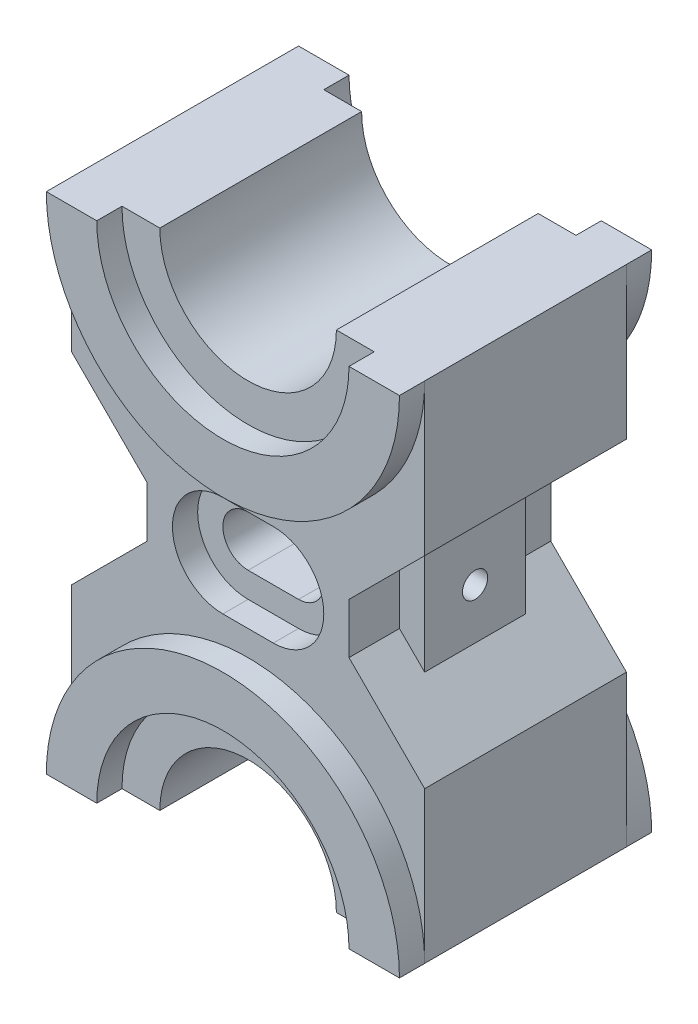
from build123d import *
from build123d.topology import SkipClean

# Parameters (mm, degrees)
SKETCH1_W           = 140
SKETCH1_H           = 200
BOSS_EXTRUDE1_DEPTH = 100
CUT_EXTRUDE1_DEPTH  = 100
CUT_EXTRUDE2_DEPTH  = 100
BOSS_EXTRUDE2_DEPTH = 10
CUT_EXTRUDE7_DEPTH  = 30
CUT_EXTRUDE8_DEPTH  = 10
CUT_EXTRUDE9_DEPTH  = 50
CUT_EXTRUDE10_DEPTH = 50
CUT_EXTRUDE11_DEPTH = 10
CUT_EXTRUDE12_START = -10
CUT_EXTRUDE12_DEPTH = 10
CUT_EXTRUDE13_DEPTH = 141
SKETCH19_R          = 5
CUT_EXTRUDE16_DEPTH = 30
CUT_EXTRUDE18_DEPTH = 60
CUT_EXTRUDE19_DEPTH = 10
SKETCH27_W          = 10
SKETCH27_H          = 80
CUT_EXTRUDE25_DEPTH = 177
CUT_EXTRUDE26_DEPTH = 10
SKETCH29_W          = 72.11102551
SKETCH29_H          = 10
EXTRUDE_THIN1_DEPTH = 10
CUT_EXTRUDE27_START = -10
CUT_EXTRUDE27_DEPTH = 10
BOSS_EXTRUDE4_START = -10
BOSS_EXTRUDE4_DEPTH = 10
CUT_EXTRUDE28_DEPTH = 150
CUT_EXTRUDE29_DEPTH = 10
BOSS_EXTRUDE5_DEPTH = 10
CUT_EXTRUDE30_START = -10
CUT_EXTRUDE30_DEPTH = 10
CUT_EXTRUDE31_START = -10
CUT_EXTRUDE31_DEPTH = 10
BOSS_EXTRUDE6_START = -10
BOSS_EXTRUDE6_DEPTH = 10
CUT_EXTRUDE32_DEPTH = 10
CUT_EXTRUDE33_DEPTH = 49
CUT_EXTRUDE34_START = -10
CUT_EXTRUDE34_DEPTH = 10
CUT_EXTRUDE42_START = -30.15
SKETCH43_R          = 5
CUT_EXTRUDE42_DEPTH = 30.15
SKETCH44_R          = 5
CUT_EXTRUDE43_DEPTH = 30.15
SKETCH45_R          = 5
CUT_EXTRUDE44_DEPTH = 120


with BuildPart() as part:
    # Sketch1 → Boss-Extrude1 (new body)
    with BuildSketch(Plane.XY):
        with Locations((70, 100)):
            Rectangle(SKETCH1_W, SKETCH1_H)
    extrude(amount=BOSS_EXTRUDE1_DEPTH)

    # Sketch2 → Cut-Extrude1 (cut)
    with BuildSketch(Plane.XY.offset(100)):
        Polygon((0, 140), (20, 120), (20, 80), (0, 60), align=None)
        Polygon((140, 140), (120, 120), (120, 80), (140, 60), align=None)
    extrude(amount=-CUT_EXTRUDE1_DEPTH, mode=Mode.SUBTRACT)

    # Sketch4 → Cut-Extrude2 (cut)
    with BuildSketch(Plane.XY.offset(30)):
        Polygon((20, 120), (30, 110), (30, 90), (20, 80), align=None)
    extrude(amount=-CUT_EXTRUDE2_DEPTH, mode=Mode.SUBTRACT)

    # Sketch9 → Boss-Extrude2 (add)
    with BuildSketch(Plane(origin=(0, 0, 30), x_dir=(-1, 0, 0), z_dir=(0, 0, -1))):
        Polygon((-30, 110), (-20, 120), (-20, 80), (-30, 90), align=None)
    extrude(amount=BOSS_EXTRUDE2_DEPTH)

    # Sketch10 → Cut-Extrude7 (cut)
    with BuildSketch(Plane.XY.offset(100)):
        Polygon((20, 120), (30, 110), (30, 90), (20, 80), align=None)
    extrude(amount=-CUT_EXTRUDE7_DEPTH, mode=Mode.SUBTRACT)

    # Sketch11 → Cut-Extrude8 (cut)
    with BuildSketch(Plane(origin=(0, 0, 20), x_dir=(-1, 0, 0), z_dir=(0, 0, -1))):
        Polygon((-30, 110), (-20, 120), (-20, 80), (-30, 90), align=None)
    extrude(amount=-CUT_EXTRUDE8_DEPTH, mode=Mode.SUBTRACT)

    # Sketch13 → Cut-Extrude9 (cut)
    with BuildSketch(Plane.XY.offset(70)):
        Polygon((120, 120), (110, 110), (110, 90), (120, 80), align=None)
    extrude(amount=CUT_EXTRUDE9_DEPTH, mode=Mode.SUBTRACT)

    # Sketch14 → Cut-Extrude10 (cut)
    with BuildSketch(Plane.XY.offset(30)):
        Polygon((120, 120), (110, 110), (110, 90), (120, 80), align=None)
    extrude(amount=-CUT_EXTRUDE10_DEPTH, mode=Mode.SUBTRACT)

    # Sketch15 → Cut-Extrude11 (cut)
    with BuildSketch(Plane(origin=(0, 0, 0), x_dir=(-1, 0, 0), z_dir=(0, 0, -1))):
        with BuildLine():
            Line((-120, 200), (-20, 200))
            ThreePointArc((-20, 200), (-70, 150), (-120, 200))
        make_face()
    extrude(amount=-CUT_EXTRUDE11_DEPTH, mode=Mode.SUBTRACT)

    # Sketch16 → Cut-Extrude12 (cut)
    with BuildSketch(Plane.XY.offset(100).offset(CUT_EXTRUDE12_START)):
        with BuildLine():
            Line((20, 200), (120, 200))
            ThreePointArc((120, 200), (70, 150), (20, 200))
        make_face()
    extrude(amount=CUT_EXTRUDE12_DEPTH, mode=Mode.SUBTRACT)

    # Sketch17 → Cut-Extrude13 (cut)
    with BuildSketch(Plane.XY.offset(90)):
        with BuildLine():
            Line((35, 200), (105, 200))
            ThreePointArc((105, 200), (70, 165), (35, 200))
        make_face()
    extrude(amount=-CUT_EXTRUDE13_DEPTH, mode=Mode.SUBTRACT)

    # Sketch19 → Cut-Extrude16 (cut)
    with BuildSketch(Plane(origin=(120, 0, 0), x_dir=(0, 0, -1), z_dir=(1, 0, 0))):
        with Locations((-50, 100)):
            Circle(SKETCH19_R)
    extrude(amount=-CUT_EXTRUDE16_DEPTH, mode=Mode.SUBTRACT)

    # Sketch20 → Cut-Extrude18 (cut)
    with BuildSketch(Plane.XY.offset(20)):
        with BuildLine():
            Line((59.999, 110), (79.999, 110))
            ThreePointArc((79.999, 110), (89.999, 100), (79.999, 90))
            Line((79.999, 90), (59.999, 90))
            ThreePointArc((59.999, 90), (49.999, 100), (59.999, 110))
        make_face()
    extrude(amount=CUT_EXTRUDE18_DEPTH, mode=Mode.SUBTRACT)

    # Sketch21 → Cut-Extrude19 (cut)
    with BuildSketch(Plane.XY.offset(10)):
        with BuildLine():
            Line((59.999, 120), (79.999, 120))
            ThreePointArc((79.999, 120), (99.999, 100), (79.999, 80))
            Line((79.999, 80), (59.999, 80))
            ThreePointArc((59.999, 80), (39.999, 100), (59.999, 120))
        make_face()
    extrude(amount=CUT_EXTRUDE19_DEPTH, mode=Mode.SUBTRACT)

    # Sketch27 → Cut-Extrude25 (cut)
    with BuildSketch(Plane(origin=(0, 0, 0), x_dir=(0, 0, -1), z_dir=(1, 0, 0))):
        with Locations((-95, 100)):
            Rectangle(SKETCH27_W, SKETCH27_H)
        with Locations((-5, 100)):
            Rectangle(SKETCH27_W, SKETCH27_H)
    extrude(amount=CUT_EXTRUDE25_DEPTH, mode=Mode.SUBTRACT)

    # Sketch28 → Cut-Extrude26 (cut)
    with BuildSketch(Plane.XY.offset(100)):
        with BuildLine():
            ThreePointArc((33.944487245, 140), (9.074283374, 165.531796484), (0, 200))
            Line((0, 200), (0, 140))
            Line((0, 140), (33.944487245, 140))
        make_face()
        with BuildLine():
            ThreePointArc((140, 200), (130.925716626, 165.531796484), (106.055512755, 140))
            Line((106.055512755, 140), (140, 140))
            Line((140, 140), (140, 200))
        make_face()
    extrude(amount=-CUT_EXTRUDE26_DEPTH, mode=Mode.SUBTRACT)

    # Sketch29 → Extrude-Thin1 (add)
    with BuildSketch(Plane.XY.offset(100)):
        with Locations((70, 145)):
            Rectangle(SKETCH29_W, SKETCH29_H)
        with BuildLine():
            ThreePointArc((140, 200), (70, 130), (0, 200))
            Line((0, 200), (10, 200))
            ThreePointArc((10, 200), (70, 140), (130, 200))
            Line((130, 200), (140, 200))
        make_face()
    extrude(amount=-EXTRUDE_THIN1_DEPTH)

    # Sketch30 → Cut-Extrude27 (cut)
    with BuildSketch(Plane(origin=(0, 0, 0), x_dir=(-1, 0, 0), z_dir=(0, 0, -1)).offset(CUT_EXTRUDE27_START)):
        with BuildLine():
            ThreePointArc((-106.055512755, 140), (-130.925716626, 165.531796484), (-140, 200))
            Line((-140, 200), (-140, 140))
            Line((-140, 140), (-106.055512755, 140))
        make_face()
        with BuildLine():
            ThreePointArc((0, 200), (-9.074283374, 165.531796484), (-33.944487245, 140))
            Line((-33.944487245, 140), (0, 140))
            Line((0, 140), (0, 200))
        make_face()
    extrude(amount=CUT_EXTRUDE27_DEPTH, mode=Mode.SUBTRACT)

    # Sketch31 → Boss-Extrude4 (add)
    with BuildSketch(Plane(origin=(0, 0, 0), x_dir=(-1, 0, 0), z_dir=(0, 0, -1)).offset(BOSS_EXTRUDE4_START)):
        with BuildLine():
            Line((0, 200), (-20, 200))
            ThreePointArc((-20, 200), (-70, 150), (-120, 200))
            Line((-120, 200), (-140, 200))
            ThreePointArc((-140, 200), (-70, 130), (0, 200))
        make_face()
    extrude(amount=BOSS_EXTRUDE4_DEPTH)

    # Sketch32 → Cut-Extrude28 (cut)
    with BuildSketch(Plane(origin=(0, 0, 0), x_dir=(-1, 0, 0), z_dir=(0, 0, -1))):
        with BuildLine():
            Line((-105, 0), (-35, 0))
            ThreePointArc((-35, 0), (-70, 35), (-105, 0))
        make_face()
    extrude(amount=-CUT_EXTRUDE28_DEPTH, mode=Mode.SUBTRACT)

    # Sketch33 → Cut-Extrude29 (cut)
    with BuildSketch(Plane.XY.offset(100)):
        with BuildLine():
            Line((0, 60), (0, 0))
            ThreePointArc((0, 0), (9.074283374, 34.468203516), (33.944487245, 60))
            Line((33.944487245, 60), (0, 60))
        make_face()
        with BuildLine():
            ThreePointArc((106.055512755, 60), (130.925716626, 34.468203516), (140, 0))
            Line((140, 0), (140, 60))
            Line((140, 60), (106.055512755, 60))
        make_face()
    extrude(amount=-CUT_EXTRUDE29_DEPTH, mode=Mode.SUBTRACT)

    # Sketch34 → Boss-Extrude5 (add)
    with SkipClean():  # the faces are left unmerged after this step: merging them gives an invalid solid
        with BuildSketch(Plane.XY.offset(100)):
            with BuildLine():
                Line((105, 0), (140, 0))
                ThreePointArc((140, 0), (70, 70), (0, 0))
                Line((0, 0), (35, 0))
                ThreePointArc((35, 0), (70, 35), (105, 0))
            make_face()
        extrude(amount=-BOSS_EXTRUDE5_DEPTH)

    # Sketch35 → Cut-Extrude30 (cut)
    with SkipClean():  # the faces are left unmerged after this step: merging them gives an invalid solid
        with BuildSketch(Plane.XY.offset(100).offset(CUT_EXTRUDE30_START)):
            with BuildLine():
                ThreePointArc((120, 0), (70, 50), (20, 0))
                Line((20, 0), (35, 0))
                ThreePointArc((35, 0), (70, 35), (105, 0))
                Line((105, 0), (120, 0))
            make_face()
        extrude(amount=CUT_EXTRUDE30_DEPTH, mode=Mode.SUBTRACT)

    # Sketch36 → Cut-Extrude31 (cut)
    with SkipClean():  # the faces are left unmerged after this step: merging them gives an invalid solid
        with BuildSketch(Plane(origin=(0, 0, 0), x_dir=(-1, 0, 0), z_dir=(0, 0, -1)).offset(CUT_EXTRUDE31_START)):
            with BuildLine():
                Line((-140, 60), (-140, 0))
                ThreePointArc((-140, 0), (-130.925716626, 34.468203516), (-106.055512755, 60))
                Line((-106.055512755, 60), (-140, 60))
            make_face()
            with BuildLine():
                Line((0, 60), (-33.944487245, 60))
                ThreePointArc((-33.944487245, 60), (-9.074283374, 34.468203516), (0, 0))
                Line((0, 0), (0, 60))
            make_face()
        extrude(amount=CUT_EXTRUDE31_DEPTH, mode=Mode.SUBTRACT)

    # Sketch37 → Boss-Extrude6 (add)
    with SkipClean():  # the faces are left unmerged after this step: merging them gives an invalid solid
        with BuildSketch(Plane(origin=(0, 0, 0), x_dir=(-1, 0, 0), z_dir=(0, 0, -1)).offset(BOSS_EXTRUDE6_START)):
            with BuildLine():
                Line((-105, 0), (-140, 0))
                ThreePointArc((-140, 0), (-70, 70), (0, 0))
                Line((0, 0), (-35, 0))
                ThreePointArc((-35, 0), (-70, 35), (-105, 0))
            make_face()
        extrude(amount=BOSS_EXTRUDE6_DEPTH)

    # Sketch38 → Cut-Extrude32 (cut)
    with SkipClean():  # the faces are left unmerged after this step: merging them gives an invalid solid
        with BuildSketch(Plane(origin=(0, 0, 0), x_dir=(-1, 0, 0), z_dir=(0, 0, -1))):
            with BuildLine():
                Line((-120, 0), (-105, 0))
                ThreePointArc((-105, 0), (-70, 35), (-35, 0))
                Line((-35, 0), (-20, 0))
                ThreePointArc((-20, 0), (-70, 50), (-120, 0))
            make_face()
        extrude(amount=-CUT_EXTRUDE32_DEPTH, mode=Mode.SUBTRACT)

    # Sketch39 → Cut-Extrude33 (cut)
    with SkipClean():  # the faces are left unmerged after this step: merging them gives an invalid solid
        with BuildSketch(Plane(origin=(0, 0, 80), x_dir=(-1, 0, 0), z_dir=(0, 0, -1))):
            with BuildLine():
                Line((-79.999, 110), (-59.999, 110))
                ThreePointArc((-59.999, 110), (-49.999, 100), (-59.999, 90))
                Line((-59.999, 90), (-79.999, 90))
                ThreePointArc((-79.999, 90), (-89.999, 100), (-79.999, 110))
            make_face()
        extrude(amount=-CUT_EXTRUDE33_DEPTH, mode=Mode.SUBTRACT)

    # Sketch40 → Cut-Extrude34 (cut)
    with SkipClean():  # the faces are left unmerged after this step: merging them gives an invalid solid
        with BuildSketch(Plane.XY.offset(90).offset(CUT_EXTRUDE34_START)):
            with BuildLine():
                Line((79.999, 80), (59.999, 80))
                ThreePointArc((59.999, 80), (39.999, 100), (59.999, 120))
                Line((59.999, 120), (79.999, 120))
                ThreePointArc((79.999, 120), (99.999, 100), (79.999, 80))
            make_face()
        extrude(amount=CUT_EXTRUDE34_DEPTH, mode=Mode.SUBTRACT)

    # Cut-Extrude15: read off the stored shape, not the designer's step
    # Cut-Extrude15: loft between two sections, ruled curve by curve
    with SkipClean():  # the faces are left unmerged after this step: merging them gives an invalid solid
        cut_extrude15_from = [
            Edge.make_three_point_arc((50, 95, 50), (50, 100, 55), (50, 105, 50)),
            Edge.make_three_point_arc((50, 105, 50), (50, 100, 45), (50, 95, 50)),
        ]
        cut_extrude15_to = [
            Edge.make_three_point_arc((20, 95, 50), (20, 100, 55), (20, 105, 50)),
            Edge.make_three_point_arc((20, 105, 50), (20, 100, 45), (20, 95, 50)),
        ]
        cut_extrude15 = Solid(Shell([*[Face.make_surface_from_curves(cut_extrude15_from[k], cut_extrude15_to[k]) for k in range(2)], Face(Wire(cut_extrude15_from)), Face(Wire(cut_extrude15_to))]))
        add(cut_extrude15, mode=Mode.SUBTRACT)

    # Sketch43 → Cut-Extrude42 (cut)
    with SkipClean():  # the faces are left unmerged after this step: merging them gives an invalid solid
        with BuildSketch(Plane.ZY.offset(-20).offset(CUT_EXTRUDE42_START)):
            with Locations(Location((50, 100, 0), (0, 0, 180))):
                Circle(SKETCH43_R)
        extrude(amount=CUT_EXTRUDE42_DEPTH, mode=Mode.SUBTRACT)

    # Sketch44 → Cut-Extrude43 (cut)
    with SkipClean():  # the faces are left unmerged after this step: merging them gives an invalid solid
        with BuildSketch(Plane(origin=(120, 0, 0), x_dir=(0, 0, -1), z_dir=(1, 0, 0))):
            with Locations((-50, 100)):
                Circle(SKETCH44_R)
        extrude(amount=-CUT_EXTRUDE43_DEPTH, mode=Mode.SUBTRACT)

    # Sketch45 → Cut-Extrude44 (cut)
    with SkipClean():  # the faces are left unmerged after this step: merging them gives an invalid solid
        with BuildSketch(Plane(origin=(120, 0, 0), x_dir=(0, 0, -1), z_dir=(1, 0, 0))):
            with Locations((-50, 100)):
                Circle(SKETCH45_R)
        extrude(amount=-CUT_EXTRUDE44_DEPTH, mode=Mode.SUBTRACT)


solid = part.part
